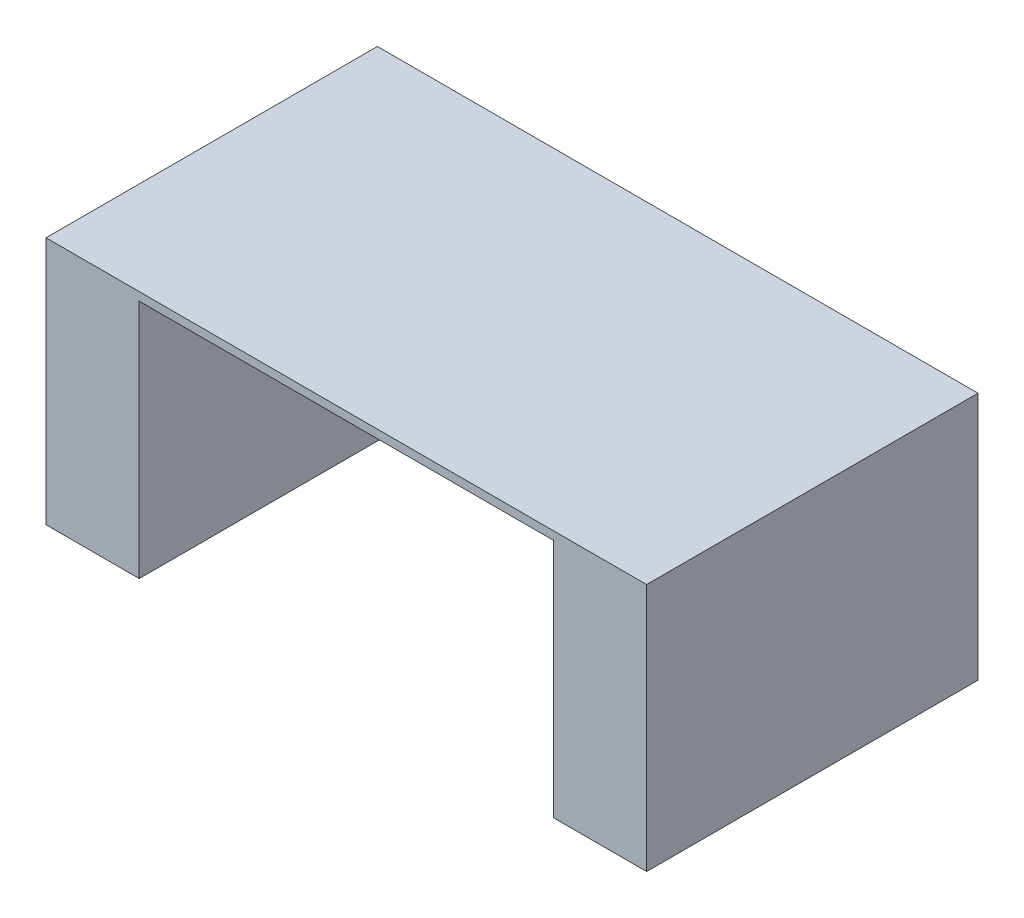
from build123d import *

# Parameters (mm, degrees)
SKETCH4_W           = 290
SKETCH4_H           = 160
BOSS_EXTRUDE3_DEPTH = 120
SKETCH5_W           = 200
SKETCH5_H           = 160
CUT_EXTRUDE2_DEPTH  = 116


with BuildPart() as part:
    # Sketch4 → Boss-Extrude3 (new body)
    with BuildSketch(Plane(origin=(0, 0, 0), x_dir=(1, 0, 0), z_dir=(0, 1, 0))):
        Rectangle(SKETCH4_W, SKETCH4_H)
    extrude(amount=BOSS_EXTRUDE3_DEPTH)

    # Sketch5 → Cut-Extrude2 (cut)
    with BuildSketch(Plane(origin=(0, 0, 0), x_dir=(1, 0, 0), z_dir=(0, 1, 0))):
        Rectangle(SKETCH5_W, SKETCH5_H)
    extrude(amount=CUT_EXTRUDE2_DEPTH, mode=Mode.SUBTRACT)


solid = part.part
